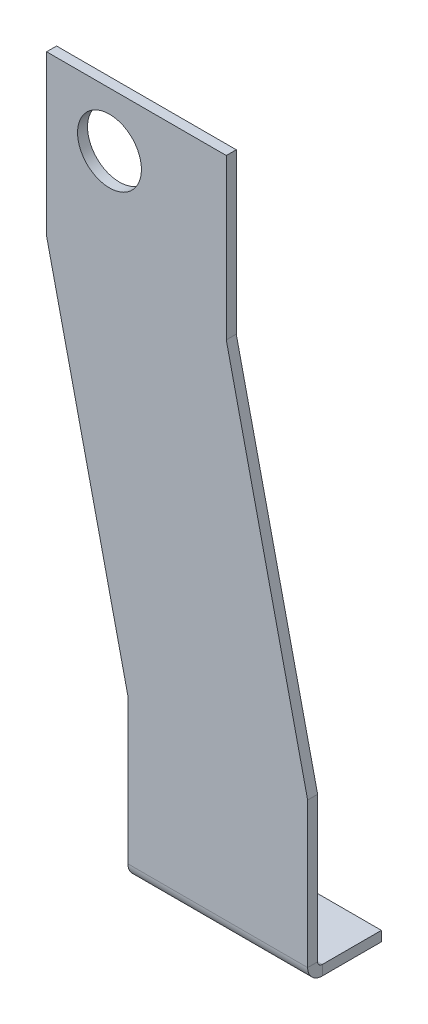
from build123d import *

# Parameters (mm, degrees)
SKETCH1_R                    = 5.08
BASE_FLANGE1_DEPTH           = 1.5875
EDGE_FLANGE1_STRIP_W         = 7.8232
EDGE_FLANGE1_STRIP_H         = 1.5875
EDGE_FLANGE1_STRIP_CUT_DEPTH = 28.575
EDGE_FLANGE1_DEPTH           = 28.575


# Sheet-metal steps are written as plain solids
with BuildPart() as part:
    # Sketch1 → Base-Flange1 (new body)
    with BuildSketch(Plane.XY):
        Polygon((0, -25.4), (12.93876, -82.30362), (12.93876, -107.70362), (41.51376, -107.70362), (41.51376, -82.30362), (28.575, -25.4), (28.575, 0), (0, 0), align=None)
        with Locations((9.99998, -8.6741)):
            Circle(SKETCH1_R, mode=Mode.SUBTRACT)
    extrude(amount=-BASE_FLANGE1_DEPTH)

    # Edge-Flange1 strip (across the edge) → Edge-Flange1 strip cut (cut)
    with BuildSketch(Plane(origin=(41.51376, -107.70362, -1.5875), x_dir=(0, 1, 0), z_dir=(-1, 0, 0))):
        with Locations((-1.5875, -0.79375)):
            Rectangle(EDGE_FLANGE1_STRIP_W, EDGE_FLANGE1_STRIP_H)
    extrude(amount=EDGE_FLANGE1_STRIP_CUT_DEPTH, mode=Mode.SUBTRACT)

    # Edge-Flange1 section (across the edge) → Edge-Flange1 (add)
    with BuildSketch(Plane(origin=(41.51376, -107.70362, -1.5875), x_dir=(0, 1, 0), z_dir=(-1, 0, 0))):
        with BuildLine():
            Line((0, 0.7366), (0, 10.14222))
            Line((0, 10.14222), (1.5875, 10.14222))
            Line((1.5875, 10.14222), (1.5875, 0.7366))
            ThreePointArc((1.5875, 0.7366), (1.803245145, 0.215745145), (2.3241, 0))
            Line((2.3241, 0), (2.3241, -1.5875))
            ThreePointArc((2.3241, -1.5875), (0.68071313, -0.90678687), (0, 0.7366))
        make_face()
    extrude(amount=EDGE_FLANGE1_DEPTH)


solid = part.part
